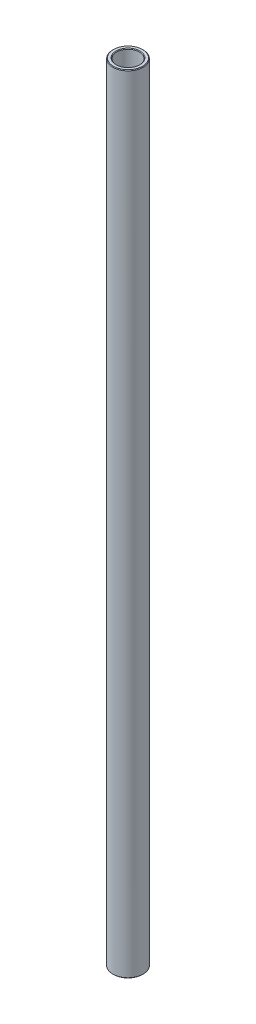
from build123d import *

# Parameters (mm, degrees)
SKETCH1_W     = 1.5875
SKETCH1_H     = 330.2
CHAMFER1_SIZE = 0.254


with BuildPart() as part:
    # Sketch1 → Revolve1 (revolve)
    with BuildSketch(Plane.XY):
        with Locations((5.55625, 0)):
            Rectangle(SKETCH1_W, SKETCH1_H)
    revolve(axis=Axis((0, 11.60859375, 0), (0, -1, 0)))

    # Chamfer1
    chamfer1_edges = [part.edges().sort_by_distance(p)[0] for p in [
        (-4.7625, -165.1, 0),
        (-6.35, -165.1, 0),
        (-6.35, 165.1, 0),
        (-4.7625, 165.1, 0),
    ]]
    chamfer(chamfer1_edges, length=CHAMFER1_SIZE)


solid = part.part
